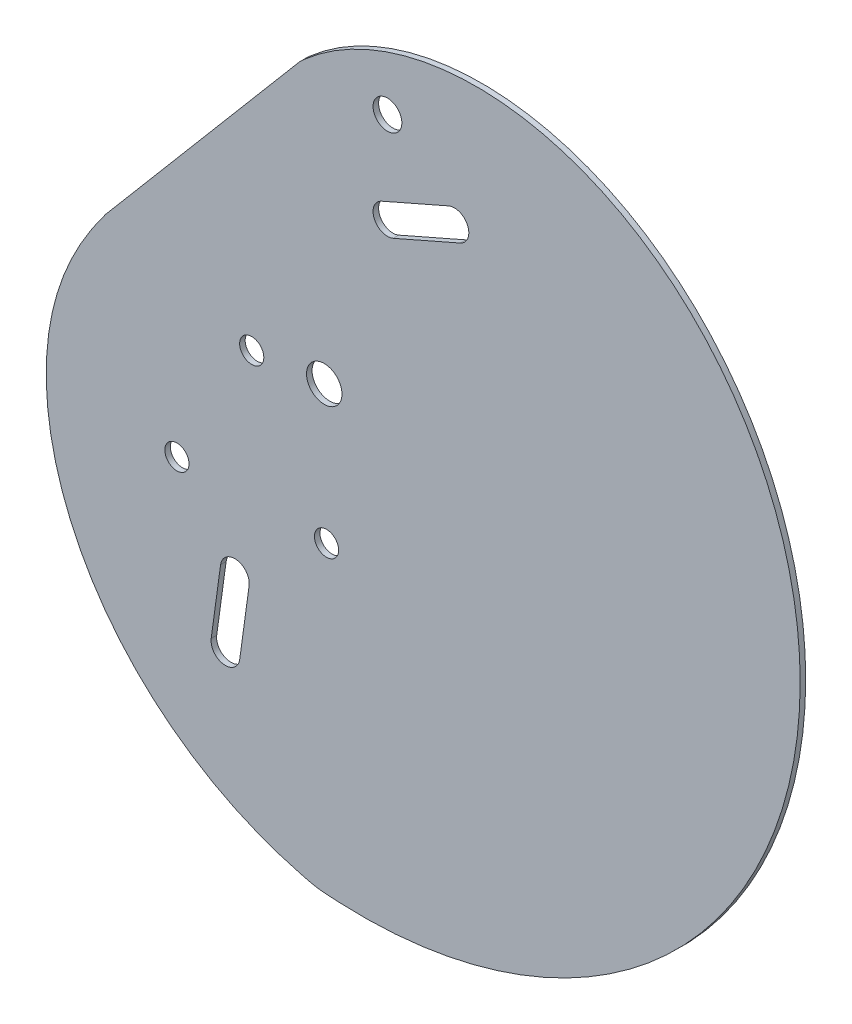
from build123d import *

# Parameters (mm, degrees)
BOSS_EXTRUDE1_START     = -0.479643116
BOSS_EXTRUDE1_OUTLINE_R = 3.175
BOSS_EXTRUDE1_DEPTH     = 0.959286232
CUT_EXTRUDE1_DEPTH      = 113.825609005
CUT_EXTRUDE1_DEPTH_BACK = 113.825609005
BOSS_EXTRUDE2_DEPTH     = 0.959286232
M4_CLEARANCE_HOLE1_D    = 4.2
FILLET1_R               = 10
SKETCH7_W               = 13.91508681
SKETCH7_H               = 14.554044878
BOSS_EXTRUDE3_DEPTH     = 0.959286232
SKETCH14_R              = 3.075
SKETCH14_R_2            = 2.5
CUT_EXTRUDE4_DEPTH      = 0.959286232


# Read off the part's stored shape, not the designer's step: Boss-Extrude1
with BuildPart() as part:
    # Boss-Extrude1 outline → Boss-Extrude1 (new body)
    with BuildSketch(Plane.XY.offset(BOSS_EXTRUDE1_START)):
        with BuildLine():
            add(Edge.make_bspline(
                [(-1.261284319, -76.388996664), (-0.976706936, -76.433000958), (-0.405700337, -76.500288673), (0.20528297, -76.543128655), (0.635947633, -76.565923488), (0.943803396, -76.583753699), (1.516577668, -76.625352645), (2.394728617, -76.679422652), (3.180819277, -76.713700374), (4.198037, -76.751687246), (6.052140639, -76.794272093), (8.655318967, -76.775789965), (11.799230285, -76.631186754), (14.930811608, -76.362150817), (19.092729282, -75.837698968), (24.252600304, -74.870904239), (30.336691794, -73.215166518), (38.249637718, -70.355302933), (47.664657668, -65.580710673), (57.878240574, -58.05265885), (69.647247229, -45.860449013), (80.17301629, -27.133451477), (84.253863041, -1.504791655), (79.559994743, 19.841206748), (70.879686514, 34.940163896), (62.021642873, 44.705365527), (51.090741107, 52.264081212), (38.576471747, 57.054085928), (25.100477493, 58.560382298), (13.770836895, 56.694329393), (5.225744009, 53.179291686), (-0.757485487, 49.527464518), (-5.179825642, 45.648133226), (-8.217128683, 42.311123306), (-10.283747679, 39.728556446), (-12.145398141, 37.129923022), (-13.803593656, 34.630220241), (-15.026366639, 32.787217268), (-15.757749026, 31.815043574), (-16.457283709, 31.008797547), (-17.314853043, 30.212425612), (-18.832098717, 29.140541156), (-20.579433545, 27.921014995), (-21.851448321, 26.952812158), (-22.922913486, 26.025576334), (-23.911333005, 25.095774574), (-25.043884789, 23.905717811), (-26.24444516, 22.476950142), (-27.667877154, 20.603207832), (-29.166272015, 18.381706059), (-30.682003525, 16.030489806), (-31.841745016, 14.323419156), (-32.792926522, 13.025871938), (-33.760991701, 11.771777118), (-35.193517942, 10.031827499), (-37.094774354, 7.688586111), (-39.650513176, 4.306101851), (-42.651423752, -0.366044153), (-45.535555759, -6.547251373), (-47.502970249, -13.211657775), (-48.684497464, -22.369909682), (-47.609886804, -33.732208724), (-42.864240814, -46.345132644), (-36.564129821, -55.468027352), (-30.429657579, -61.727526273), (-25.356811503, -65.867230195), (-20.797895182, -68.82985851), (-16.986888823, -70.897278381), (-14.057126153, -72.294062473), (-11.057489783, -73.537247471), (-8.528639781, -74.438248663), (-6.705355358, -75.008839512), (-5.69991862, -75.303300743), (-4.914663461, -75.525329661), (-4.043728169, -75.751750303), (-3.477018465, -75.89115289), (-3.15620306, -75.974687703), (-2.718728151, -76.089597955), (-2.113164636, -76.236262909), (-1.545861702, -76.34499237), (-1.261284319, -76.388996664)],
                knots=[0, 0, 0, 0, 0.000976562, 0.001953125, 0.002929688, 0.00390625, 0.005859375, 0.0078125, 0.009765625, 0.01171875, 0.015625, 0.0234375, 0.03125, 0.0390625, 0.046875, 0.0625, 0.078125, 0.09375, 0.125, 0.15625, 0.1875, 0.25, 0.3125, 0.375, 0.40625, 0.4375, 0.46875, 0.5, 0.53125, 0.5625, 0.578125, 0.59375, 0.609375, 0.6171875, 0.625, 0.6328125, 0.640625, 0.6484375, 0.65234375, 0.65625, 0.6640625, 0.671875, 0.67578125, 0.6796875, 0.681640625, 0.68359375, 0.6875, 0.69140625, 0.6953125, 0.703125, 0.7109375, 0.71875, 0.72265625, 0.7265625, 0.734375, 0.7421875, 0.75, 0.765625, 0.78125, 0.796875, 0.8125, 0.84375, 0.875, 0.90625, 0.921875, 0.9375, 0.953125, 0.9609375, 0.96875, 0.9765625, 0.984375, 0.98828125, 0.990234375, 0.9921875, 0.994140625, 0.99609375, 0.997070312, 0.998046875, 0.999023438, 1, 1, 1, 1], degree=3))
        make_face()
        Circle(BOSS_EXTRUDE1_OUTLINE_R, mode=Mode.SUBTRACT)
    extrude(amount=BOSS_EXTRUDE1_DEPTH)

    # Sketch2 → Cut-Extrude1 (cut, two sides: drawn at the far end of the back side and taken through both)
    with BuildSketch(Plane.XY.offset(-CUT_EXTRUDE1_DEPTH_BACK)):
        Polygon((-4.119310262, 46.506747557), (-37.979985712, 6.507923903), (-21.102439727, 46.506747557), align=None)
    extrude(amount=CUT_EXTRUDE1_DEPTH + CUT_EXTRUDE1_DEPTH_BACK, mode=Mode.SUBTRACT)

    # Sketch6 → Boss-Extrude2 (add)
    with BuildSketch(Plane.XY.offset(0.479643116)):
        Polygon((-4.119310262, 46.506747557), (-18.797566669, 29.167666698), (-15.709388941, 26.553395222), (-1.031132534, 43.892476081), align=None)
    extrude(amount=-BOSS_EXTRUDE2_DEPTH)

    # M4 Clearance Hole1 (through all)
    with Locations(Plane.XY.offset(0.479643116)):
        with Locations((-12.593900177, -1.272585975), (0.396480879, -23.772585975), (-25.584281234, -23.772585975)):
            Hole(M4_CLEARANCE_HOLE1_D / 2)

    # Fillet1
    fillet1_edges = [part.edges().sort_by_distance(p)[0] for p in [
        (-4.119310262, 46.506747557, 0),
    ]]
    fillet(fillet1_edges, radius=FILLET1_R)

    # Sketch7 → Boss-Extrude3 (add)
    with BuildSketch(Plane.XY.offset(0.479643116)):
        with Locations((0.167886722, 0.454424986)):
            Rectangle(SKETCH7_W, SKETCH7_H)
    extrude(amount=-BOSS_EXTRUDE3_DEPTH)

    # Sketch14 → Cut-Extrude4 (cut)
    with BuildSketch(Plane.XY.offset(0.479643116)):
        Circle(SKETCH14_R)
        with Locations((10.980481562, 45.990024488)):
            Circle(SKETCH14_R_2)
        with BuildLine():
            Line((9.976048944, 32.474429955), (21.605937727, 37.576947657))
            ThreePointArc((21.605937727, 37.576947657), (24.899718531, 36.29203209), (23.614802964, 32.998251286))
            Line((23.614802964, 32.998251286), (11.984914181, 27.895733584))
            ThreePointArc((11.984914181, 27.895733584), (8.691133377, 29.180649151), (9.976048944, 32.474429955))
        make_face()
        with BuildLine():
            Line((-13.047820049, -36.881525512), (-14.677617691, -48.77033368))
            ThreePointArc((-14.677617691, -48.77033368), (-17.493993901, -50.907627539), (-19.631287761, -48.091251329))
            Line((-19.631287761, -48.091251329), (-18.001490119, -36.202443161))
            ThreePointArc((-18.001490119, -36.202443161), (-15.185113909, -34.065149302), (-13.047820049, -36.881525512))
        make_face()
    extrude(amount=-CUT_EXTRUDE4_DEPTH, mode=Mode.SUBTRACT)


solid = part.part
